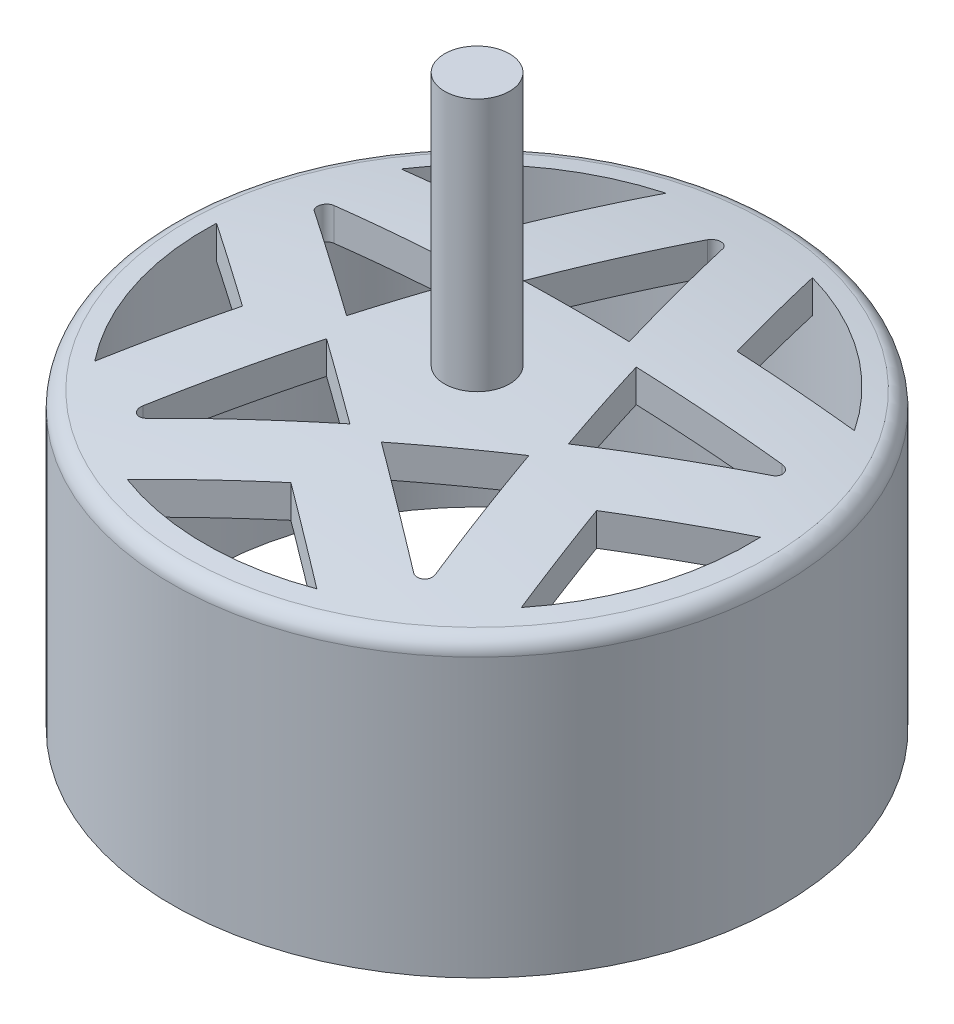
from build123d import *

# Parameters (mm, degrees)
CUT_EXTRUDE3_DEPTH = 44.91042
CUT_EXTRUDE7_DEPTH = 44.91042
FILLET1_R          = 1


with BuildPart() as part:
    # Sketch1 → Revolve1 (revolve)
    with BuildSketch(Plane.XY):
        with BuildLine():
            Line((-18.75, 0), (-18.75, 17.954213))
            ThreePointArc((-18.75, 17.954213), (-10.400154, 18.968524), (-2, 19.4))
            Line((-2, 19.4), (-2, 35))
            Line((-2, 35), (0, 35))
            Line((0, 35), (0, 17.416539))
            ThreePointArc((0, 17.416539), (-8.395945, 17.119829), (-16.75, 16.231181))
            Line((-16.75, 16.231181), (-16.75, 0))
            Line((-16.75, 0), (-18.75, 0))
        make_face()
    revolve(axis=Axis((0, -0.123973, 0), (0, 1, 0)))

    # Sketch2 → Cut-Extrude3 (cut, through all)
    with BuildSketch(Plane(origin=(0, 35, 0), x_dir=(1, 0, 0), z_dir=(0, 1, 0))):
        with BuildLine():
            ThreePointArc((-16.735368, 0.699976), (-15.930197, -5.176035), (-13.127761, -10.403095))
            Line((-13.127761, -10.403095), (-10.898138, -3.54102))
            Line((-10.898138, -3.54102), (-16.735368, 0.699976))
        make_face()
        with BuildLine():
            Line((0, -11.45898), (-5.83723, -15.699976))
            ThreePointArc((-5.83723, -15.699976), (0, -16.75), (5.83723, -15.699976))
            Line((5.83723, -15.699976), (0, -11.45898))
        make_face()
        with BuildLine():
            Line((-13.950633, 9.27051), (-6.73542, 9.27051))
            Line((-6.73542, 9.27051), (-4.505796, 16.132585))
            ThreePointArc((-4.505796, 16.132585), (-9.845403, 13.551035), (-13.950633, 9.27051))
        make_face()
        with BuildLine():
            Line((16.735368, 0.699976), (10.898138, -3.54102))
            Line((10.898138, -3.54102), (13.127761, -10.403095))
            ThreePointArc((13.127761, -10.403095), (15.930197, -5.176035), (16.735368, 0.699976))
        make_face()
        with BuildLine():
            Line((4.505796, 16.132585), (6.73542, 9.27051))
            Line((6.73542, 9.27051), (13.950633, 9.27051))
            ThreePointArc((13.950633, 9.27051), (9.845403, 13.551035), (4.505796, 16.132585))
        make_face()
    extrude(amount=-CUT_EXTRUDE3_DEPTH, mode=Mode.SUBTRACT)

    # Sketch3 → Cut-Extrude7 (cut, through all)
    with BuildSketch(Plane(origin=(0, 35, 0), x_dir=(1, 0, 0), z_dir=(0, 1, 0))):
        with BuildLine():
            ThreePointArc((-13.804158, 4.985243), (-14.279687, 4.639751), (-14.098051, 4.080734))
            Line((-14.098051, 4.080734), (-6.836492, -1.195097))
            Line((-6.836492, -1.195097), (-4.828378, 4.985243))
            Line((-4.828378, 4.985243), (-13.804158, 4.985243))
        make_face()
        with BuildLine():
            ThreePointArc((0.475528, 14.653743), (0, 14.999234), (-0.475528, 14.653743))
            Line((-0.475528, 14.653743), (-3.249197, 6.117268))
            Line((-3.249197, 6.117268), (3.249197, 6.117268))
            Line((3.249197, 6.117268), (0.475528, 14.653743))
        make_face()
        with BuildLine():
            Line((13.789591, 4.98051), (4.813811, 4.98051))
            Line((4.813811, 4.98051), (6.821925, -1.19983))
            Line((6.821925, -1.19983), (14.083484, 4.076001))
            ThreePointArc((14.083484, 4.076001), (14.26512, 4.635018), (13.789591, 4.98051))
        make_face()
        with BuildLine():
            Line((6.224296, -3.039144), (0.966985, -6.858804))
            Line((0.966985, -6.858804), (8.228544, -12.134636))
            ThreePointArc((8.228544, -12.134636), (8.816329, -12.134636), (8.997964, -11.575619))
            Line((8.997964, -11.575619), (6.224296, -3.039144))
        make_face()
        with BuildLine():
            Line((-0.966985, -6.858804), (-6.224296, -3.039144))
            Line((-6.224296, -3.039144), (-8.997964, -11.575619))
            ThreePointArc((-8.997964, -11.575619), (-8.816329, -12.134636), (-8.228544, -12.134636))
            Line((-8.228544, -12.134636), (-0.966985, -6.858804))
        make_face()
    extrude(amount=-CUT_EXTRUDE7_DEPTH, mode=Mode.SUBTRACT)

    # Fillet1
    fillet1_edges = [part.edges().sort_by_distance(p)[0] for p in [
        (18.75, 17.954213, 0),
    ]]
    fillet(fillet1_edges, radius=FILLET1_R)


solid = part.part
